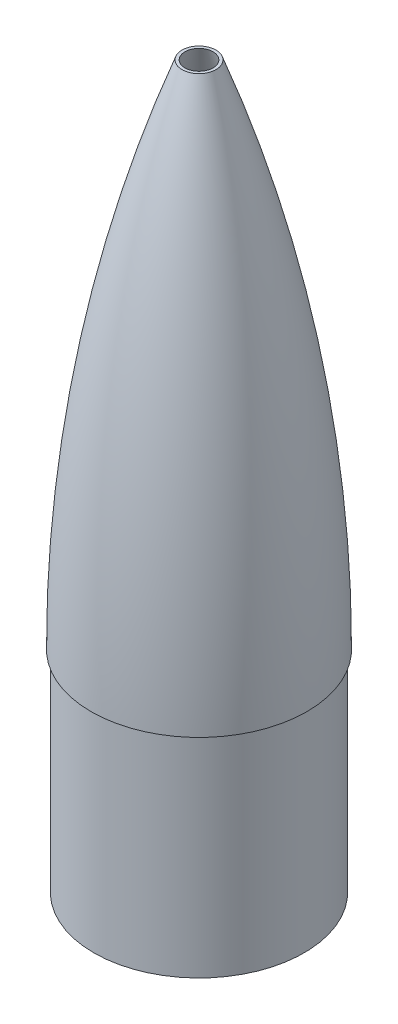
from build123d import *

# Parameters (mm, degrees)
BOSS_EXTRUDE1_DEPTH      = 10
BOSS_EXTRUDE1_DEPTH_BACK = 152.4
SKETCH2_R                = 76.2
SKETCH2_R_2              = 74.2
SKETCH6_R                = 45.027407712
CUT_EXTRUDE1_DEPTH       = 40


with BuildPart() as part:
    # Sketch1 → Revolve3 (revolve)
    with BuildSketch(Plane.XY):
        with BuildLine():
            Line((0, 400), (0, 401.853426775))
            ThreePointArc((0, 401.853426775), (58.468341276, 204.695759977), (78.2, 0))
            Line((78.2, 0), (76.2, 0))
            ThreePointArc((76.2, 0), (56.977268898, 201.872568324), (0, 396.489212171))
            Line((0, 396.489212171), (0, 400))
        make_face()
    revolve(axis=Axis((0, 400, 0), (0, 1, 0)))

    # Sketch2 → Boss-Extrude1 (add, two sides: drawn at the far end of the back side and taken through both)
    with BuildSketch(Plane(origin=(0, 0, 0), x_dir=(1, 0, 0), z_dir=(0, 1, 0)).offset(-BOSS_EXTRUDE1_DEPTH_BACK)):
        Circle(SKETCH2_R)
        Circle(SKETCH2_R_2, mode=Mode.SUBTRACT)
    extrude(amount=BOSS_EXTRUDE1_DEPTH + BOSS_EXTRUDE1_DEPTH_BACK)

    # Sketch6 → Cut-Extrude1 (cut)
    with BuildSketch(Plane(origin=(0, 370, 0), x_dir=(-1, 0, 0), z_dir=(0, -1, 0))):
        Circle(SKETCH6_R)
    extrude(amount=-CUT_EXTRUDE1_DEPTH, mode=Mode.SUBTRACT)


solid = part.part
